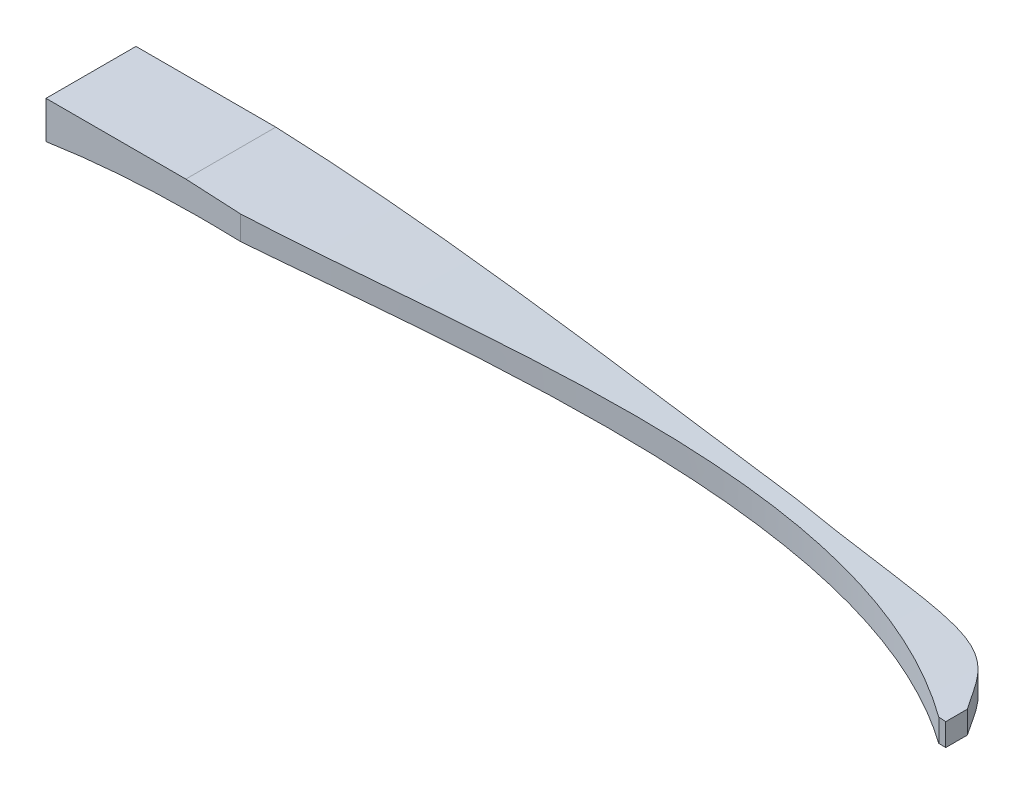
from build123d import *

# Parameters (mm, degrees)
SKETCH1_W           = 152.4
SKETCH1_H           = 15.24
BOSS_EXTRUDE1_DEPTH = 19.05
CUT_EXTRUDE1_DEPTH  = 155.340273746
CUT_EXTRUDE2_DEPTH  = 19.05


with BuildPart() as part:
    # Sketch1 → Boss-Extrude1 (new body)
    with BuildSketch(Plane(origin=(0, 0, 0), x_dir=(1, 0, 0), z_dir=(0, 1, 0))):
        with Locations((76.2, 7.62)):
            Rectangle(SKETCH1_W, SKETCH1_H)
    extrude(amount=BOSS_EXTRUDE1_DEPTH)

    # Sketch3 → Cut-Extrude1 (cut, through all)
    with BuildSketch(Plane(origin=(0, 0, -15.24), x_dir=(-1, 0, 0), z_dir=(0, 0, -1))):
        with BuildLine():
            Line((0, 0), (0, 12.7))
            add(Edge.make_bspline(
                [(0, 12.7), (-51.879743488, 20.604752027), (-101.189319173, 1.545562583), (-152.4, 0)],
                knots=[0, 0, 0, 0, 1, 1, 1, 1], degree=3))
            Line((-152.4, 0), (0, 0))
        make_face()
        with BuildLine():
            Line((-152.4, 19.05), (-152.4, 3.81))
            add(Edge.make_bspline(
                [(-23.688922128, 19.05), (-66.923585572, 17.364582471), (-109.28951983, 7.317055945), (-152.4, 3.81)],
                knots=[0.153903767, 0.153903767, 0.153903767, 0.153903767, 1, 1, 1, 1], degree=3))
            Line((-23.688922128, 19.05), (-152.4, 19.05))
        make_face()
    extrude(amount=-CUT_EXTRUDE1_DEPTH, mode=Mode.SUBTRACT)

    # Sketch4 → Cut-Extrude2 (cut)
    with BuildSketch(Plane(origin=(0, 19.05, 0), x_dir=(1, 0, 0), z_dir=(0, 1, 0))):
        with BuildLine():
            add(Edge.make_bspline(
                [(32.905376539, 0), (71.091780144, 4.308290587), (115.232795591, 24.969729608), (151.22723466, 0)],
                knots=[0, 0, 0, 0, 1, 1, 1, 1], degree=3))
            Line((32.905376539, 0), (151.22723466, 0))
        make_face()
        with BuildLine():
            add(Edge.make_bspline(
                [(111.97860474, 15.24), (125.254498594, 14.46323396), (146.792400064, 15.617836062), (149.813458513, 7.354798631), (152.4, 3.658781514)],
                knots=[0, 0, 0, 0, 0.517262006, 1, 1, 1, 1], degree=3))
            Line((152.4, 3.658781514), (152.4, 15.24))
            Line((152.4, 15.24), (111.97860474, 15.24))
        make_face()
    extrude(amount=-CUT_EXTRUDE2_DEPTH, mode=Mode.SUBTRACT)


solid = part.part
